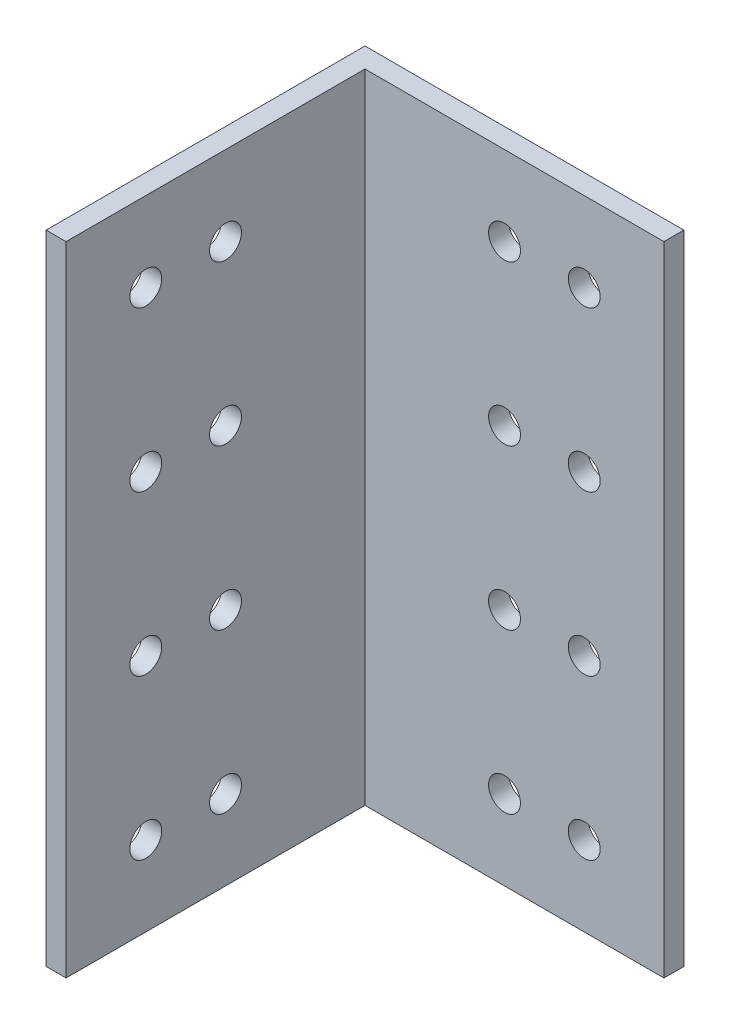
from build123d import *

# Parameters (mm, degrees)
BOSS_EXTRUDE1_DEPTH = 101.6
SKETCH3_R           = 2.54
CUT_EXTRUDE1_DEPTH  = 116.047210418
SKETCH4_R           = 2.54
CUT_EXTRUDE2_DEPTH  = 116.047210418


with BuildPart() as part:
    # Sketch2 → Boss-Extrude1 (new body)
    with BuildSketch(Plane(origin=(0, 0, 0), x_dir=(1, 0, 0), z_dir=(0, 1, 0))):
        Polygon((-25.4, 25.4), (-25.4, -25.4), (-22.225, -25.4), (-22.225, 22.225), (25.4, 22.225), (25.4, 25.4), align=None)
    extrude(amount=BOSS_EXTRUDE1_DEPTH)

    # Sketch3 → Cut-Extrude1 (cut, through all)
    with BuildSketch(Plane.XY.offset(-22.225)):
        with Locations((12.7, 88.9)):
            Circle(SKETCH3_R)
        with Locations((0, 88.9)):
            Circle(SKETCH3_R)
        with Locations((0, 63.5)):
            Circle(SKETCH3_R)
        with Locations((12.7, 63.5)):
            Circle(SKETCH3_R)
        with Locations((0, 38.1)):
            Circle(SKETCH3_R)
        with Locations((12.7, 38.1)):
            Circle(SKETCH3_R)
        with Locations((0, 12.7)):
            Circle(SKETCH3_R)
        with Locations((12.7, 12.7)):
            Circle(SKETCH3_R)
    extrude(amount=-CUT_EXTRUDE1_DEPTH, mode=Mode.SUBTRACT)

    # Sketch4 → Cut-Extrude2 (cut, through all)
    with BuildSketch(Plane(origin=(-22.225, 0, 0), x_dir=(0, 0, -1), z_dir=(1, 0, 0))):
        with Locations((-12.7, 88.9)):
            Circle(SKETCH4_R)
        with Locations((0, 88.9)):
            Circle(SKETCH4_R)
        with Locations((-12.7, 63.5)):
            Circle(SKETCH4_R)
        with Locations((0, 63.5)):
            Circle(SKETCH4_R)
        with Locations((-12.7, 38.1)):
            Circle(SKETCH4_R)
        with Locations((0, 38.1)):
            Circle(SKETCH4_R)
        with Locations((-12.7, 12.7)):
            Circle(SKETCH4_R)
        with Locations((0, 12.7)):
            Circle(SKETCH4_R)
    extrude(amount=-CUT_EXTRUDE2_DEPTH, mode=Mode.SUBTRACT)


solid = part.part
